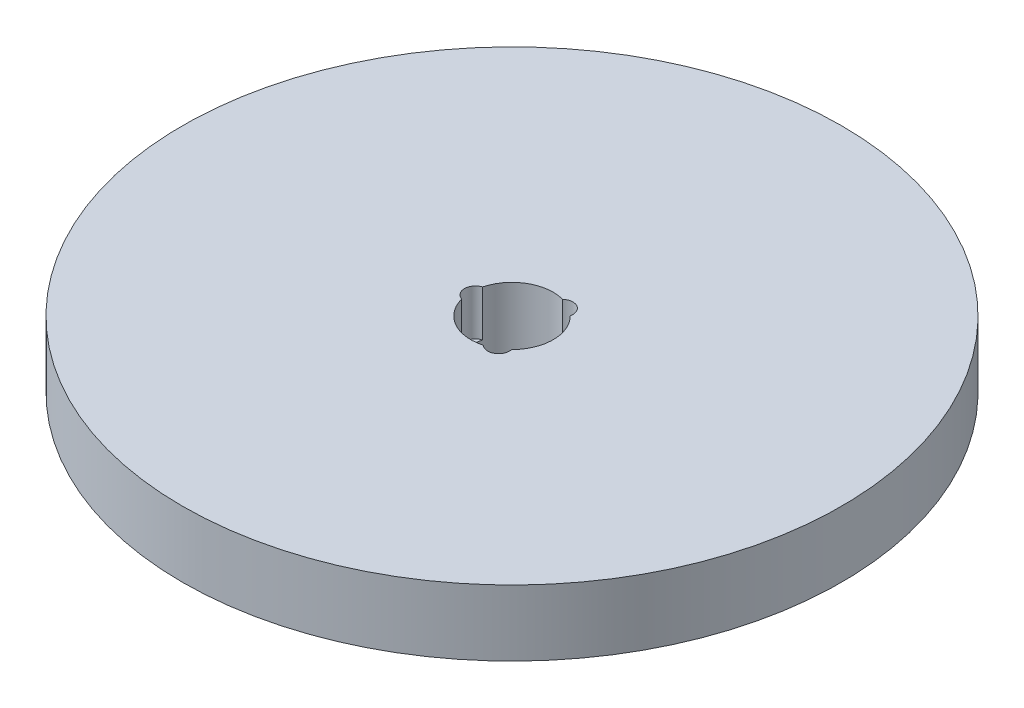
from build123d import *

# Parameters (mm, degrees)
SKETCH1_R           = 60
BOSS_EXTRUDE1_DEPTH = 12
SKETCH2_R           = 7.5
CUT_EXTRUDE1_DEPTH  = 86.697141143
SKETCH3_R           = 1.986946411
CUT_EXTRUDE2_DEPTH  = 8.361553361
CIRPATTERN1_COUNT   = 3


with BuildPart() as part:
    # Sketch1 → Boss-Extrude1 (new body)
    with BuildSketch(Plane(origin=(0, 0, 0), x_dir=(1, 0, 0), z_dir=(0, 1, 0))):
        Circle(SKETCH1_R)
    extrude(amount=BOSS_EXTRUDE1_DEPTH)

    # Sketch2 → Cut-Extrude1 (cut, through all)
    with BuildSketch(Plane(origin=(0, 0, 0), x_dir=(1, 0, 0), z_dir=(0, 1, 0))):
        Circle(SKETCH2_R)
    extrude(amount=CUT_EXTRUDE1_DEPTH, mode=Mode.SUBTRACT)

    # Sketch3 → Cut-Extrude2 (cut)
    with BuildSketch(Plane(origin=(0, 12, 0), x_dir=(1, 0, 0), z_dir=(0, 1, 0))):
        with Locations((-6.657299382, 0)):
            Circle(SKETCH3_R)
    cut_extrude2 = extrude(amount=-CUT_EXTRUDE2_DEPTH, mode=Mode.SUBTRACT)

    # CirPattern1: Cut-Extrude2 ×3 about axis
    cirpattern1_axis = Axis((0, 0, 0), (0, 1, 0))
    for i in range(1, CIRPATTERN1_COUNT):
        add(cut_extrude2.rotate(cirpattern1_axis, i * 360 / CIRPATTERN1_COUNT), mode=Mode.SUBTRACT)


solid = part.part
